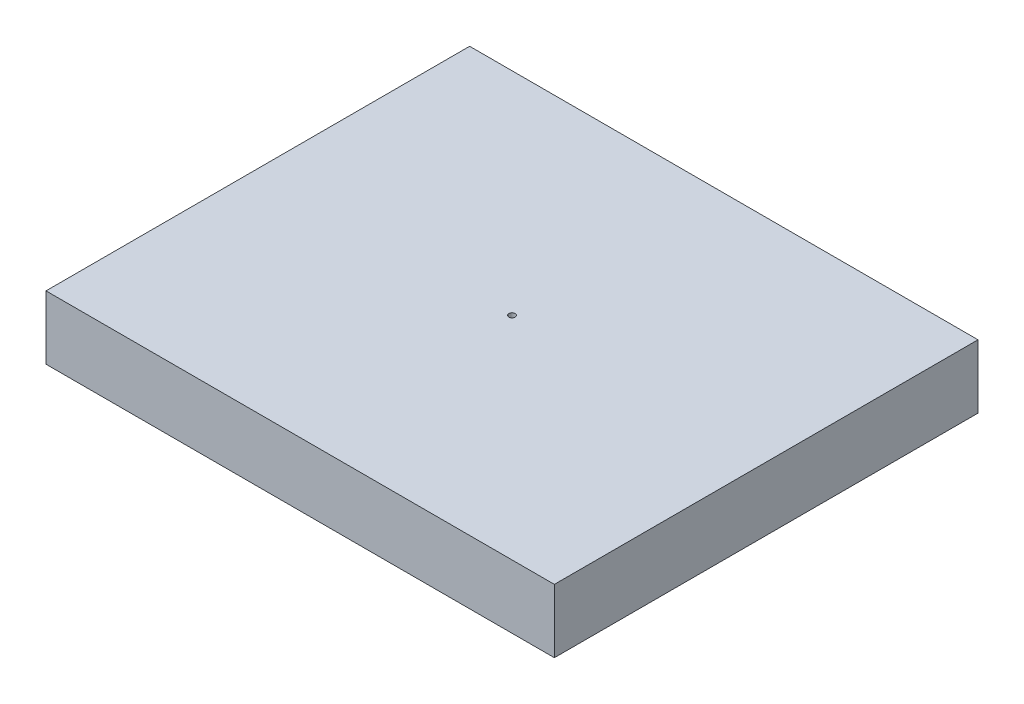
from build123d import *

# Parameters (mm, degrees)
SKETCH1_W           = 240
SKETCH1_H           = 200
BOSS_EXTRUDE1_DEPTH = 15
SKETCH2_R           = 1.5
CUT_EXTRUDE1_DEPTH  = 160.059737206


with BuildPart() as part:
    # Sketch1 → Boss-Extrude1 (new, symmetric)
    with BuildSketch(Plane(origin=(0, 0, 0), x_dir=(1, 0, 0), z_dir=(0, 1, 0))):
        Rectangle(SKETCH1_W, SKETCH1_H)
    extrude(amount=BOSS_EXTRUDE1_DEPTH, both=True)

    # Sketch2 → Cut-Extrude1 (cut, through all)
    with BuildSketch(Plane(origin=(0, 15, 0), x_dir=(1, 0, 0), z_dir=(0, 1, 0))):
        Circle(SKETCH2_R)
    extrude(amount=-CUT_EXTRUDE1_DEPTH, mode=Mode.SUBTRACT)


solid = part.part
